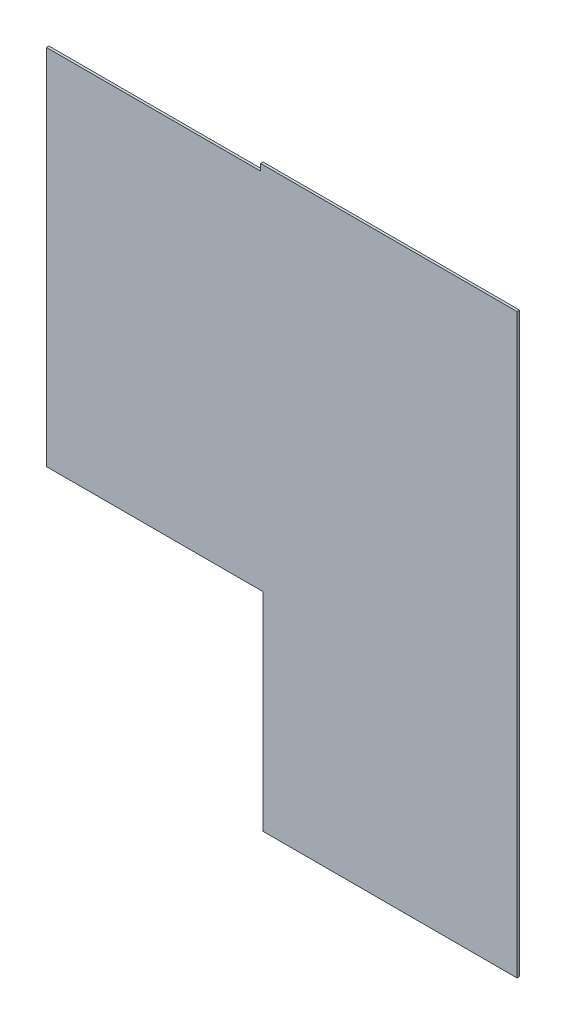
from build123d import *

# Parameters (mm, degrees)
EXTRUDE_1_DEPTH = 6


with BuildPart() as part:
    # Эскиз2 → Бобышка-Вытянуть1 (new body)
    with BuildSketch(Plane.XY):
        Polygon((1138.3, -949), (524, -949), (524, -447), (0, -447), (0, 431), (518, 431), (518, 447), (1138.3, 447), align=None)
    extrude(amount=-EXTRUDE_1_DEPTH)


solid = part.part
